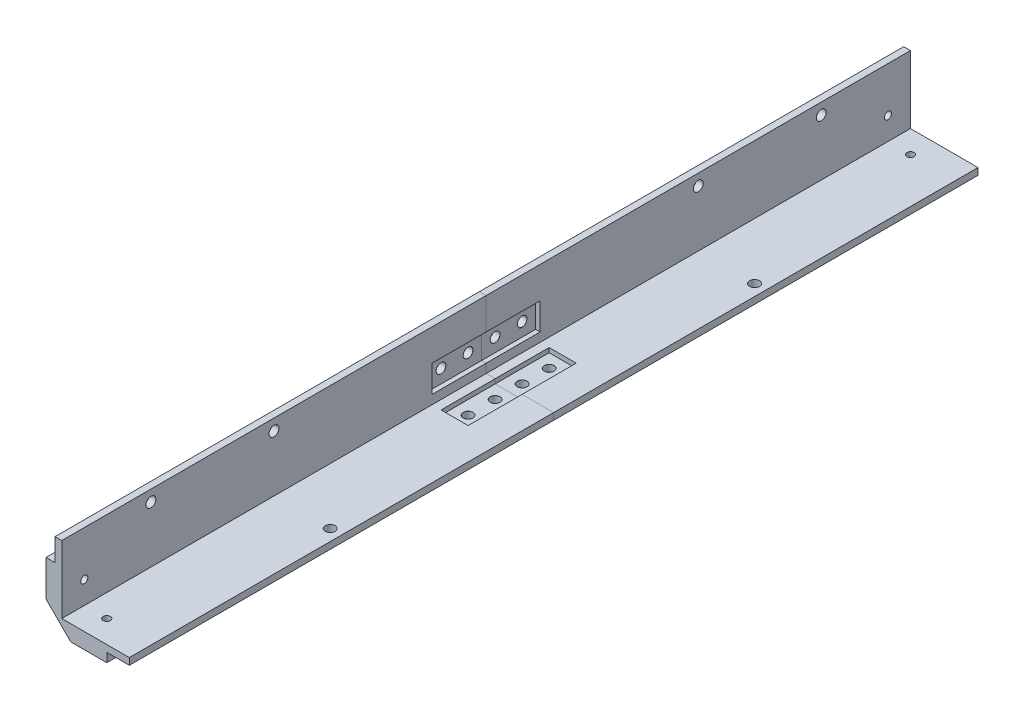
from build123d import *

# Parameters (mm, degrees)
BOSS_EXTRUDE1_DEPTH            = 188.45
SKETCH6_W                      = 188.45
SKETCH6_H                      = 3
BOSS_EXTRUDE2_DEPTH            = 10
SKETCH7_W                      = 13
SKETCH7_H                      = 188.45
BOSS_EXTRUDE3_DEPTH            = 4
SKETCH8_W                      = 3
SKETCH8_H                      = 188.45
BOSS_EXTRUDE4_DEPTH            = 10
SKETCH9_W                      = 188.45
SKETCH9_H                      = 13
BOSS_EXTRUDE5_DEPTH            = 4
CSK_FOR_M3_SFHCS1_D            = 3.2
CSK_FOR_M3_SFHCS1_CSINK_D      = 6.72
CSK_FOR_M3_SFHCS1_CSINK_ANGLE  = 90
CSK_FOR_M3_SFHCS2_D            = 3.2
CSK_FOR_M3_SFHCS2_CSINK_D      = 6.72
CSK_FOR_M3_SFHCS2_CSINK_ANGLE  = 90
F_4_4_4_4_DIAMETER_HOLE1_D     = 4.4
F_4_4_4_4_DIAMETER_HOLE1_DEPTH = 10
F_4_4_4_4_DIAMETER_HOLE1_TIP   = 1.321893362
F_4_4_4_4_DIAMETER_HOLE2_D     = 4.4
F_4_4_4_4_DIAMETER_HOLE2_DEPTH = 10
F_4_4_4_4_DIAMETER_HOLE2_TIP   = 1.321893362
SKETCH14_W                     = 50
SKETCH14_H                     = 30
CUT_EXTRUDE1_DEPTH             = 10
FILLET1_R                      = 1.5
BOSS_EXTRUDE7_DEPTH            = 100
BOSS_EXTRUDE8_DEPTH            = 50
BOSS_EXTRUDE9_DEPTH            = 50
SKETCH23_W                     = 48
SKETCH23_H                     = 12
CUT_EXTRUDE2_DEPTH             = 2
SKETCH26_W                     = 12
SKETCH26_H                     = 48
CUT_EXTRUDE3_DEPTH             = 2


with BuildPart() as part:
    # Sketch1 → Boss-Extrude1 (new body)
    with BuildSketch(Plane.XY.offset(280)):
        Polygon((-7, 4), (4, -7), (7, -7), (7, -3), (20, -3), (20, 0), (0, 0), (0, 20), (-3, 20), (-3, 7), (-7, 7), align=None)
    extrude(amount=-BOSS_EXTRUDE1_DEPTH)

    # Sketch6 → Boss-Extrude2 (add)
    with BuildSketch(Plane(origin=(20, 0, 0), x_dir=(0, 0, -1), z_dir=(1, 0, 0))):
        with Locations((-185.775, -1.5)):
            Rectangle(SKETCH6_W, SKETCH6_H)
    extrude(amount=BOSS_EXTRUDE2_DEPTH)

    # Sketch7 → Boss-Extrude3 (add)
    with BuildSketch(Plane.XZ.offset(3)):
        with Locations((13.5, 185.775)):
            Rectangle(SKETCH7_W, SKETCH7_H)
    extrude(amount=BOSS_EXTRUDE3_DEPTH)

    # Sketch8 → Boss-Extrude4 (add)
    with BuildSketch(Plane(origin=(0, 20, 0), x_dir=(1, 0, 0), z_dir=(0, 1, 0))):
        with Locations((-1.5, -185.775)):
            Rectangle(SKETCH8_W, SKETCH8_H)
    extrude(amount=BOSS_EXTRUDE4_DEPTH)

    # Sketch9 → Boss-Extrude5 (add)
    with BuildSketch(Plane.ZY.offset(3)):
        with Locations((185.775, 13.5)):
            Rectangle(SKETCH9_W, SKETCH9_H)
    extrude(amount=BOSS_EXTRUDE5_DEPTH)

    # CSK for M3 SFHCS1 (through all)
    with Locations(Plane.XZ.offset(7)):
        with Locations((10, 270)):
            CounterSinkHole(CSK_FOR_M3_SFHCS1_D / 2, CSK_FOR_M3_SFHCS1_CSINK_D / 2, counter_sink_angle=CSK_FOR_M3_SFHCS1_CSINK_ANGLE)

    # CSK for M3 SFHCS2 (through all)
    with Locations(Plane.ZY.offset(7)):
        with Locations((270, 10)):
            CounterSinkHole(CSK_FOR_M3_SFHCS2_D / 2, CSK_FOR_M3_SFHCS2_CSINK_D / 2, counter_sink_angle=CSK_FOR_M3_SFHCS2_CSINK_ANGLE)

    # Ø4.4 (4.4) Diameter Hole1
    with Locations(Plane.ZY.offset(3)):
        with Locations((138.6625, 25), (185.775, 25), (240.3875, 25)):
            Hole(F_4_4_4_4_DIAMETER_HOLE1_D / 2, depth=F_4_4_4_4_DIAMETER_HOLE1_DEPTH)
            with Locations((0, 0, -(F_4_4_4_4_DIAMETER_HOLE1_DEPTH + F_4_4_4_4_DIAMETER_HOLE1_TIP / 2))):  # 118° drill point
                Cone(0, F_4_4_4_4_DIAMETER_HOLE1_D / 2, F_4_4_4_4_DIAMETER_HOLE1_TIP, mode=Mode.SUBTRACT)

    # Ø4.4 (4.4) Diameter Hole2
    with Locations(Plane.XZ.offset(3)):
        with Locations((25, 185.775)):
            Hole(F_4_4_4_4_DIAMETER_HOLE2_D / 2, depth=F_4_4_4_4_DIAMETER_HOLE2_DEPTH)
            with Locations((0, 0, -(F_4_4_4_4_DIAMETER_HOLE2_DEPTH + F_4_4_4_4_DIAMETER_HOLE2_TIP / 2))):  # 118° drill point
                Cone(0, F_4_4_4_4_DIAMETER_HOLE2_D / 2, F_4_4_4_4_DIAMETER_HOLE2_TIP, mode=Mode.SUBTRACT)

    # Sketch14 → Cut-Extrude1 (cut)
    with BuildSketch(Plane.ZY.offset(7)):
        with Locations((116.55, 15)):
            Rectangle(SKETCH14_W, SKETCH14_H)
    extrude(amount=-CUT_EXTRUDE1_DEPTH, mode=Mode.SUBTRACT)

    # Fillet1
    fillet1_edges = [part.edges().sort_by_distance(p)[0] for p in [
        (-7, 4, 210.775),
        (4, -7, 185.775),
    ]]
    fillet(fillet1_edges, radius=FILLET1_R)


with BuildPart() as body_2:
    # Mirror1: read off the stored shape, not the designer's step
    # Mirror1: mirrored copy
    add(part.part.mirror(Plane.XY.offset(91.55)))

    # Sketch22 → Boss-Extrude9 (add)
    with BuildSketch(Plane.XY.offset(41.55)):
        with BuildLine():
            Line((-6.560660172, 3.560660172), (-3, 0))
            Line((-3, 0), (0, 0))
            Line((0, 0), (0, 30))
            Line((0, 30), (-3, 30))
            Line((-3, 30), (-3, 20))
            Line((-3, 20), (-7, 20))
            Line((-7, 20), (-7, 4.621320344))
            ThreePointArc((-7, 4.621320344), (-6.885819299, 4.047295195), (-6.560660172, 3.560660172))
        make_face()
    extrude(amount=BOSS_EXTRUDE9_DEPTH)


with BuildPart() as body_3:
    # Sketch19 → Boss-Extrude7 (new body)
    with BuildSketch(Plane(origin=(0, 0, 141.55), x_dir=(-1, 0, 0), z_dir=(0, 0, -1))):
        with BuildLine():
            Line((7, 20), (3, 20))
            Line((3, 20), (0, 20))
            Line((0, 20), (0, 0))
            Line((0, 0), (3, 0))
            Line((3, 0), (6.560660172, 3.560660172))
            ThreePointArc((6.560660172, 3.560660172), (6.885819299, 4.047295195), (7, 4.621320344))
            Line((7, 4.621320344), (7, 20))
        make_face()
    extrude(amount=BOSS_EXTRUDE7_DEPTH)


with BuildPart() as part_1:
    add(part.part)

    # Sketch20 → Boss-Extrude8 (add)
    with BuildSketch(Plane(origin=(0, 0, 141.55), x_dir=(-1, 0, 0), z_dir=(0, 0, -1))):
        with BuildLine():
            Line((3, 0), (6.560660172, 3.560660172))
            ThreePointArc((6.560660172, 3.560660172), (6.885819299, 4.047295195), (7, 4.621320344))
            Line((7, 4.621320344), (7, 20))
            Line((7, 20), (3, 20))
            Line((3, 20), (3, 30))
            Line((3, 30), (0, 30))
            Line((0, 30), (0, 0))
            Line((0, 0), (3, 0))
        make_face()
    extrude(amount=BOSS_EXTRUDE8_DEPTH)


with BuildPart() as cut_extrude2_tool:
    # Sketch23 → Cut-Extrude2 (new body)
    with BuildSketch(Plane(origin=(0, 0, 0), x_dir=(0, 0, -1), z_dir=(1, 0, 0))):
        with Locations((-91.55, 10)):
            Rectangle(SKETCH23_W, SKETCH23_H)
    extrude(amount=-CUT_EXTRUDE2_DEPTH)


with BuildPart() as part_2:
    add(part_1.part)

    # Cut-Extrude2: cut by cut_extrude2_tool
    add(cut_extrude2_tool.part, mode=Mode.SUBTRACT)

    # 4.3 _4.3_ Diameter Hole1 3 outline → 4.3 _4.3_ Diameter Hole1 3 (revolve, cut)
    with BuildSketch(Plane(origin=(0, 10, 109.55), x_dir=(0, 1, 0), z_dir=(0, 0, -1))):
        Polygon((0, -2), (0, -5), (2.15, -5), (2.15, -2.025), (2.175, -2), align=None)
    revolve(axis=Axis((0, 10, 109.55), (1, 0, 0)), mode=Mode.SUBTRACT)

    # 4.3 _4.3_ Diameter Hole1 4 outline → 4.3 _4.3_ Diameter Hole1 4 (revolve, cut)
    with BuildSketch(Plane(origin=(0, 10, 97.55), x_dir=(0, 1, 0), z_dir=(0, 0, -1))):
        Polygon((0, -2), (0, -5), (2.15, -5), (2.15, -2.025), (2.175, -2), align=None)
    revolve(axis=Axis((0, 10, 97.55), (1, 0, 0)), mode=Mode.SUBTRACT)


with BuildPart() as body_2_1:
    add(body_2.part)

    # Cut-Extrude2: cut by cut_extrude2_tool
    add(cut_extrude2_tool.part, mode=Mode.SUBTRACT)

    # Ø4.3 (4.3) Diameter Hole1: read off the stored shape, not the designer's step
    # Ø4.3 (4.3) Diameter Hole1 outline → Ø4.3 (4.3) Diameter Hole1 (revolve, cut)
    with BuildSketch(Plane(origin=(0, 10, 85.55), x_dir=(0, 1, 0), z_dir=(0, 0, -1))):
        Polygon((0, -2), (0, -5), (2.15, -5), (2.15, -2.025), (2.175, -2), align=None)
    revolve(axis=Axis((0, 10, 85.55), (1, 0, 0)), mode=Mode.SUBTRACT)

    # 4.3 _4.3_ Diameter Hole1 2 outline → 4.3 _4.3_ Diameter Hole1 2 (revolve, cut)
    with BuildSketch(Plane(origin=(0, 10, 73.55), x_dir=(0, 1, 0), z_dir=(0, 0, -1))):
        Polygon((0, -2), (0, -5), (2.15, -5), (2.15, -2.025), (2.175, -2), align=None)
    revolve(axis=Axis((0, 10, 73.55), (1, 0, 0)), mode=Mode.SUBTRACT)


with BuildPart() as cut_extrude3_tool:
    # Sketch26 → Cut-Extrude3 (new body)
    with BuildSketch(Plane(origin=(0, 0, 0), x_dir=(1, 0, 0), z_dir=(0, 1, 0))):
        with Locations((10, -91.55)):
            Rectangle(SKETCH26_W, SKETCH26_H)
    extrude(amount=-CUT_EXTRUDE3_DEPTH)


with BuildPart() as part_3:
    add(part_2.part)

    # Cut-Extrude3: cut by cut_extrude3_tool
    add(cut_extrude3_tool.part, mode=Mode.SUBTRACT)

    # 4.3 _4.3_ Diameter Hole2 3 outline → 4.3 _4.3_ Diameter Hole2 3 (revolve, cut)
    with BuildSketch(Plane(origin=(10, 0, 97.55), x_dir=(1, 0, 0), z_dir=(0, 0, 1))):
        Polygon((0, -2), (0, -5), (2.15, -5), (2.15, -2.025), (2.175, -2), align=None)
    revolve(axis=Axis((10, 0, 97.55), (0, 1, 0)), mode=Mode.SUBTRACT)

    # 4.3 _4.3_ Diameter Hole2 4 outline → 4.3 _4.3_ Diameter Hole2 4 (revolve, cut)
    with BuildSketch(Plane(origin=(10, 0, 109.55), x_dir=(1, 0, 0), z_dir=(0, 0, 1))):
        Polygon((0, -2), (0, -5), (2.15, -5), (2.15, -2.025), (2.175, -2), align=None)
    revolve(axis=Axis((10, 0, 109.55), (0, 1, 0)), mode=Mode.SUBTRACT)


with BuildPart() as body_2_2:
    add(body_2_1.part)

    # Cut-Extrude3: cut by cut_extrude3_tool
    add(cut_extrude3_tool.part, mode=Mode.SUBTRACT)

    # Ø4.3 (4.3) Diameter Hole2: read off the stored shape, not the designer's step
    # Ø4.3 (4.3) Diameter Hole2 outline → Ø4.3 (4.3) Diameter Hole2 (revolve, cut)
    with BuildSketch(Plane(origin=(10, 0, 73.55), x_dir=(1, 0, 0), z_dir=(0, 0, 1))):
        Polygon((0, -2), (0, -5), (2.15, -5), (2.15, -2.025), (2.175, -2), align=None)
    revolve(axis=Axis((10, 0, 73.55), (0, 1, 0)), mode=Mode.SUBTRACT)

    # 4.3 _4.3_ Diameter Hole2 2 outline → 4.3 _4.3_ Diameter Hole2 2 (revolve, cut)
    with BuildSketch(Plane(origin=(10, 0, 85.55), x_dir=(1, 0, 0), z_dir=(0, 0, 1))):
        Polygon((0, -2), (0, -5), (2.15, -5), (2.15, -2.025), (2.175, -2), align=None)
    revolve(axis=Axis((10, 0, 85.55), (0, 1, 0)), mode=Mode.SUBTRACT)


solid = Compound([part_3.part, body_2_2.part])
